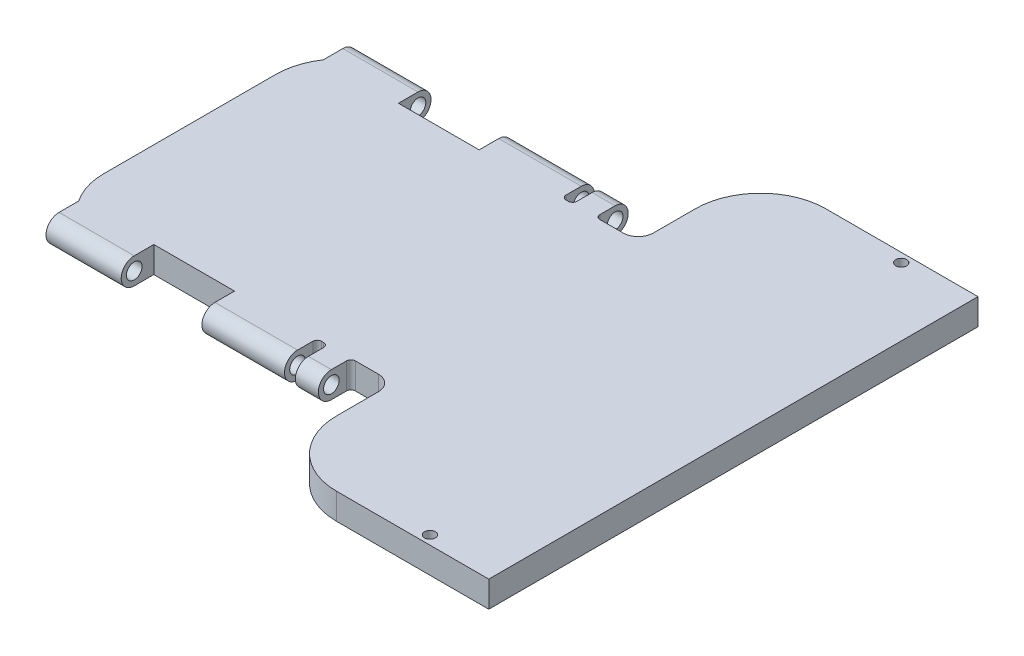
from build123d import *

# Parameters (mm, degrees)
BOSS_EXTRUDE1_DEPTH      = 8
BOSS_EXTRUDE2_DEPTH      = 46.583974855
BOSS_EXTRUDE2_DEPTH_BACK = 46.58397486
SKETCH4_R                = 2.4
SKETCH6_W                = 20
SKETCH6_H                = 3
BOSS_EXTRUDE3_DEPTH      = 30
CUT_EXTRUDE2_DEPTH       = 233.497849452
CUT_EXTRUDE2_DEPTH_BACK  = 233.497849452
SKETCH7_R                = 2
SKETCH8_W                = 40
SKETCH8_H                = 3
CUT_EXTRUDE3_DEPTH       = 40
SKETCH9_R                = 2
CUT_EXTRUDE4_DEPTH       = 40
FILLET1_R                = 20
SKETCH17_R               = 1.5
CUT_EXTRUDE10_DEPTH      = 25
SCALE1_SCALE             = 1.5
SKETCH18_W               = 192.636116151
SKETCH18_H               = 297.519421562
CUT_EXTRUDE11_DEPTH      = 304.953519557
SKETCH19_W               = 5
SKETCH19_H               = 12
CUT_EXTRUDE12_DEPTH      = 56.25
SKETCH20_W               = 35
SKETCH20_H               = 20.748828486
SKETCH20_W_2             = 15.531607356
SKETCH20_H_2             = 16.854299174
CUT_EXTRUDE13_DEPTH      = 304.953519557
FILLET2_R                = 2
FILLET3_R                = 7
FILLET4_R                = 2
SCALE2_SCALE             = 0.8
SKETCH21_R               = 1.8
BOSS_EXTRUDE4_DEPTH      = 9.6
SKETCH22_R               = 2
CUT_EXTRUDE14_DEPTH      = 270.167443306
SKETCH23_W               = 3.17304631
SKETCH23_H               = 12
SKETCH23_W_2             = 2.864071414
CUT_EXTRUDE15_DEPTH      = 270.167443306
SKETCH25_W               = 3.467321183
SKETCH25_H               = 12
CUT_EXTRUDE17_DEPTH      = 270.167443306


with BuildPart() as part:
    # Sketch1 → Boss-Extrude1 (new body)
    with BuildSketch(Plane(origin=(0, 0, 0), x_dir=(1, 0, 0), z_dir=(0, 1, 0))):
        Polygon((-120, -37.5), (-120, -75), (0, -75), (0, 75), (-120, 75), (-120, 37.5), (-220, 37.5), (-220, -37.5), align=None)
    extrude(amount=BOSS_EXTRUDE1_DEPTH)

    # Sketch4 → Boss-Extrude2 (add, two sides: drawn at the far end of the back side and taken through both)
    # profile 1 of 2: a face of its own
    with BuildSketch(Plane.ZY.offset(170).offset(-BOSS_EXTRUDE2_DEPTH_BACK)):
        with BuildLine():
            Line((37.5, 8), (43.5, 8))
            ThreePointArc((43.5, 8), (47.5, 4), (43.5, 0))
            Line((43.5, 0), (37.5, 0))
            Line((37.5, 0), (37.5, 8))
        make_face()
        with Locations((43.5, 4)):
            Circle(SKETCH4_R, mode=Mode.SUBTRACT)
    # profile 2 of 2: a face of its own
    with BuildSketch(Plane.ZY.offset(170).offset(-BOSS_EXTRUDE2_DEPTH_BACK)):
        with BuildLine():
            Line((-37.5, 0), (-43.5, 0))
            ThreePointArc((-43.5, 0), (-47.5, 4), (-43.5, 8))
            Line((-43.5, 8), (-37.5, 8))
            Line((-37.5, 8), (-37.5, 0))
        make_face()
        with Locations((-43.5, 4)):
            Circle(SKETCH4_R, mode=Mode.SUBTRACT)
    extrude(amount=BOSS_EXTRUDE2_DEPTH + BOSS_EXTRUDE2_DEPTH_BACK)

    # Sketch6 → Boss-Extrude3 (add)
    with BuildSketch(Plane(origin=(0, 0, 0), x_dir=(0, 0, -1), z_dir=(1, 0, 0))):
        with Locations((-50, 4)):
            Rectangle(SKETCH6_W, SKETCH6_H)
        with Locations((50, 4)):
            Rectangle(SKETCH6_W, SKETCH6_H)
    extrude(amount=BOSS_EXTRUDE3_DEPTH)

    # Sketch7 → Cut-Extrude2 (cut, two sides: drawn at the far end of the back side and taken through both)
    with BuildSketch(Plane(origin=(0, 5.5, 0), x_dir=(1, 0, 0), z_dir=(0, 1, 0)).offset(-CUT_EXTRUDE2_DEPTH_BACK)):
        with Locations(Location((22.5, 50, 0), (0, 0, 270))):
            Circle(SKETCH7_R)
        with Locations(Location((22.5, -50, 0), (0, 0, 270))):
            Circle(SKETCH7_R)
    extrude(amount=CUT_EXTRUDE2_DEPTH + CUT_EXTRUDE2_DEPTH_BACK, mode=Mode.SUBTRACT)

    # Sketch8 → Cut-Extrude3 (cut)
    with BuildSketch(Plane(origin=(0, 0, 0), x_dir=(0, 0, -1), z_dir=(1, 0, 0))):
        with Locations((0, 4)):
            Rectangle(SKETCH8_W, SKETCH8_H)
    extrude(amount=-CUT_EXTRUDE3_DEPTH, mode=Mode.SUBTRACT)

    # Sketch9 → Cut-Extrude4 (cut)
    with BuildSketch(Plane(origin=(0, 8, 0), x_dir=(1, 0, 0), z_dir=(0, 1, 0))):
        with Locations(Location((-32.5, 0, 0), (0, 0, 270))):
            Circle(SKETCH9_R)
    extrude(amount=-CUT_EXTRUDE4_DEPTH, mode=Mode.SUBTRACT)

    # Fillet1
    # the kernel refuses this fillet: 20 mm, written as the material it takes off along each edge
    with BuildSketch(Plane(origin=(-220, -27.947694226, -37.5), x_dir=(0, 0, 1), z_dir=(0, 1, 0))) as fillet1_piece_1:
        with BuildLine():
            CenterArc((11.17907769, 20), FILLET1_R, 236.01651728, 33.98348272)
            Line((0, 3.416025145), (-0.223581554, 3.084345648))
            ThreePointArc((-0.223581554, 3.084345648), (-0.4, 1.708012572), (-0.4, 0))
            Line((-0.4, 0), (0, -0.4))
            Line((0, -0.4), (11.17907769, -0.4))
            Line((11.17907769, -0.4), (11.17907769, 0))
        make_face()
    extrude(amount=63.895388452, mode=Mode.SUBTRACT)
    with BuildSketch(Plane(origin=(-220, -27.947694226, 37.5), x_dir=(1, 0, 0), z_dir=(0, 1, 0))) as fillet1_piece_2:
        with BuildLine():
            CenterArc((20, 11.17907769), FILLET1_R, 180, 33.98348272)
            Line((0, 11.17907769), (-0.4, 11.17907769))
            Line((-0.4, 11.17907769), (-0.4, 0))
            Line((-0.4, 0), (0, -0.4))
            ThreePointArc((0, -0.4), (1.708012572, -0.4), (3.084345648, -0.223581554))
            Line((3.084345648, -0.223581554), (3.416025145, 0))
        make_face()
    extrude(amount=63.895388452, mode=Mode.SUBTRACT)
    with BuildSketch(Plane(origin=(-120, -50, -75), x_dir=(1, 0, 0), z_dir=(0, 1, 0)), Plane(origin=(-120, -50, 75), x_dir=(0, 0, -1), z_dir=(0, 1, 0))) as fillet1_piece_3:
        with BuildLine():
            CenterArc((FILLET1_R, -FILLET1_R), FILLET1_R, 90, 90)
            Line((0, -FILLET1_R), (-FILLET1_R * 0.02, -FILLET1_R))
            Line((-FILLET1_R * 0.02, -FILLET1_R), (-FILLET1_R * 0.02, FILLET1_R * 0.02))
            Line((-FILLET1_R * 0.02, FILLET1_R * 0.02), (FILLET1_R, FILLET1_R * 0.02))
            Line((FILLET1_R, FILLET1_R * 0.02), (FILLET1_R, 0))
        make_face()
    extrude(amount=108, mode=Mode.SUBTRACT)

    # Sketch17 → Cut-Extrude10 (cut)
    with BuildSketch(Plane(origin=(0, 8, 0), x_dir=(1, 0, 0), z_dir=(0, 1, 0))):
        with Locations(Location((-75, 72.25, 0), (0, 0, 270))):
            Circle(SKETCH17_R)
        with Locations(Location((-25, 72.25, 0), (0, 0, 270))):
            Circle(SKETCH17_R)
        with Locations(Location((-25, -72.25, 0), (0, 0, 270))):
            Circle(SKETCH17_R)
        with Locations(Location((-75, -72.25, 0), (0, 0, 270))):
            Circle(SKETCH17_R)
    extrude(amount=-CUT_EXTRUDE10_DEPTH, mode=Mode.SUBTRACT)


with BuildPart() as part_1:
    # Scale1: scaled about (-95.774895805, 4, 0)
    add(part.part.scale(SCALE1_SCALE).moved(Location((47.887447902, -2, 0))))

    # Sketch18 → Cut-Extrude11 (cut, through all)
    with BuildSketch(Plane(origin=(0, 10, 0), x_dir=(1, 0, 0), z_dir=(0, 1, 0))):
        with Locations((64.205505977, 3.096142809)):
            Rectangle(SKETCH18_W, SKETCH18_H)
    extrude(amount=-CUT_EXTRUDE11_DEPTH, mode=Mode.SUBTRACT)

    # Sketch19 → Cut-Extrude12 (cut)
    with BuildSketch(Plane.XY.offset(112.5)):
        with Locations((-164.809163738, 4)):
            Rectangle(SKETCH19_W, SKETCH19_H)
    cut_extrude12 = extrude(amount=-CUT_EXTRUDE12_DEPTH, mode=Mode.SUBTRACT)

    # Mirror2: Cut-Extrude12 across plane
    add(cut_extrude12.mirror(Plane.XY), mode=Mode.SUBTRACT)

    # Sketch20 → Cut-Extrude13 (cut, through all)
    with BuildSketch(Plane(origin=(0, 10, 0), x_dir=(1, 0, 0), z_dir=(0, 1, 0))):
        with Locations((-223.406777288, -66.624414243)):
            Rectangle(SKETCH20_W, SKETCH20_H)
        with Locations((-143.974864216, -64.677149587)):
            Rectangle(SKETCH20_W_2, SKETCH20_H_2)
    cut_extrude13 = extrude(amount=-CUT_EXTRUDE13_DEPTH, mode=Mode.SUBTRACT)

    # Fillet2
    fillet2_edges = [part_1.edges().sort_by_distance(p)[0] for p in [
        (-162.309163738, 4, 56.25),
        (-167.309163738, 4, 56.25),
        (-205.906777288, 4, 56.25),
        (-240.906777288, 4, 56.25),
        (-151.740667894, 4, 56.25),
    ]]
    fillet(fillet2_edges, radius=FILLET2_R)

    # Mirror3: Cut-Extrude13 across plane
    add(cut_extrude13.mirror(Plane.XY), mode=Mode.SUBTRACT)

    # Fillet3
    fillet3_edges = [part_1.edges().sort_by_distance(p)[0] for p in [
        (-132.112552097, 4, 56.25),
        (-132.112552097, 4, -56.25),
    ]]
    fillet(fillet3_edges, radius=FILLET3_R)

    # Fillet4
    fillet4_edges = [part_1.edges().sort_by_distance(p)[0] for p in [
        (-162.309163738, 4, -56.25),
        (-167.309163738, 4, -56.25),
        (-240.906777288, 4, -56.25),
        (-205.906777288, 4, -56.25),
        (-151.740667894, 4, -56.25),
    ]]
    fillet(fillet4_edges, radius=FILLET4_R)


with BuildPart() as part_2:
    # Scale2: scaled about (-139.017271823, 4, 0)
    add(part_1.part.scale(SCALE2_SCALE).moved(Location((-27.803454365, 0.8, 0))))

    # Sketch21 → Boss-Extrude4 (add)
    with BuildSketch(Plane(origin=(0, 8.8, 0), x_dir=(1, 0, 0), z_dir=(0, 1, 0))):
        with Locations((-79.493496043, 86.7)):
            Circle(SKETCH21_R)
        with Locations((-79.493496043, -86.7)):
            Circle(SKETCH21_R)
    extrude(amount=-BOSS_EXTRUDE4_DEPTH)

    # Sketch22 → Cut-Extrude14 (cut, through all)
    with BuildSketch(Plane(origin=(0, 8.8, 0), x_dir=(1, 0, 0), z_dir=(0, 1, 0))):
        with Locations(Location((-78.432456753, 86.7, 0), (0, 0, 270))):
            Circle(SKETCH22_R)
        with Locations(Location((-78.432456753, -86.7, 0), (0, 0, 90))):
            Circle(SKETCH22_R)
    extrude(amount=-CUT_EXTRUDE14_DEPTH, mode=Mode.SUBTRACT)

    # Sketch23 → Cut-Extrude15 (cut, through all)
    with BuildSketch(Plane(origin=(0, 8.8, 0), x_dir=(1, 0, 0), z_dir=(0, 1, 0))):
        with Locations((-219.44235304, 51)):
            Rectangle(SKETCH23_W, SKETCH23_H)
        with Locations((-219.44235304, -51)):
            Rectangle(SKETCH23_W, SKETCH23_H)
        with Locations((-193.460911902, 51)):
            Rectangle(SKETCH23_W_2, SKETCH23_H)
        with Locations((-193.460911902, -51)):
            Rectangle(SKETCH23_W_2, SKETCH23_H)
    extrude(amount=-CUT_EXTRUDE15_DEPTH, mode=Mode.SUBTRACT)

    # Sketch25 → Cut-Extrude17 (cut, through all)
    with BuildSketch(Plane(origin=(0, 8.8, 0), x_dir=(1, 0, 0), z_dir=(0, 1, 0))):
        with Locations((-219.995215604, -51)):
            Rectangle(SKETCH25_W, SKETCH25_H)
        with Locations((-219.995215604, 51)):
            Rectangle(SKETCH25_W, SKETCH25_H)
    extrude(amount=-CUT_EXTRUDE17_DEPTH, mode=Mode.SUBTRACT)


solid = part_2.part
